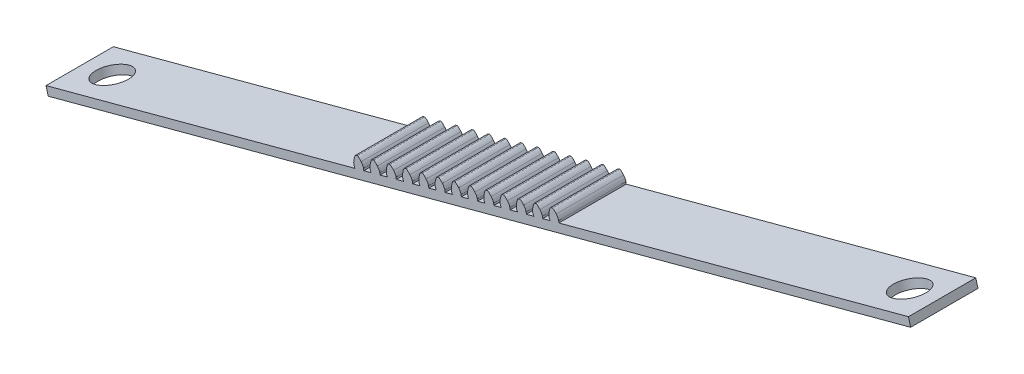
from build123d import *

# Parameters (mm, degrees)
BOSS_EXTRUDE1_DEPTH = 25.4
SKETCH2_W           = 25.4
SKETCH2_H           = 3.175
BOSS_EXTRUDE2_DEPTH = 57.15
SKETCH3_W           = 25.4
SKETCH3_H           = 3.175
BOSS_EXTRUDE3_DEPTH = 53.975
SKETCH4_R           = 6.35
CUT_EXTRUDE3_DEPTH  = 25.4
SKETCH5_R           = 6.35
CUT_EXTRUDE4_DEPTH  = 10


with BuildPart() as part:
    # Sketch1 → Boss-Extrude1 (new body)
    with BuildSketch(Plane.XY):
        with BuildLine():
            Line((44.647261736, 20.714486461), (-16.689028233, 4.279477097))
            Line((-16.689028233, 4.279477097), (-15.867277765, 1.212662598))
            Line((-15.867277765, 1.212662598), (202.166329374, 59.634591554))
            Line((202.166329374, 59.634591554), (201.344578906, 62.701406052))
            Line((201.344578906, 62.701406052), (121.586879759, 41.330394976))
            Line((121.586879759, 41.330394976), (121.513391285, 42.056075093))
            add(Edge.make_bspline(
                [(121.513391285, 42.056075093), (121.260009346, 43.020021571), (120.595314393, 43.773827223)],
                knots=[0, 0, 0, 1, 1, 1], degree=2))
            add(Edge.make_bspline(
                [(120.595314393, 43.773827223), (120.275189395, 44.15849811), (119.801750125, 44.644816566), (119.29209413, 45.027722731), (119.109538558, 44.986289964)],
                knots=[0, 0, 0, 0, 0.77483603, 1, 1, 1, 1], degree=3))
            Line((119.109538558, 44.986289964), (118.568302619, 44.841266231))
            add(Edge.make_bspline(
                [(117.887814373, 43.048354779), (117.972715311, 43.541552038), (118.139566517, 44.19943581), (118.389488473, 44.785870274), (118.568302619, 44.841266231)],
                knots=[0, 0, 0, 0, 0.77483603, 1, 1, 1, 1], degree=3))
            add(Edge.make_bspline(
                [(117.951612527, 41.101699351), (117.689074484, 42.063192458), (117.887814373, 43.048354779)],
                knots=[0, 0, 0, 1, 1, 1], degree=2))
            Line((117.951612527, 41.101699351), (118.2508097, 40.436497698))
            Line((118.2508097, 40.436497698), (115.453250762, 39.68689404))
            Line((115.453250762, 39.686894039), (115.379762288, 40.412574156))
            add(Edge.make_bspline(
                [(115.379762288, 40.412574156), (115.126380349, 41.376520634), (114.461685396, 42.130326286)],
                knots=[0, 0, 0, 1, 1, 1], degree=2))
            add(Edge.make_bspline(
                [(114.461685396, 42.130326286), (114.141560398, 42.514997173), (113.668121128, 43.001315629), (113.158465133, 43.384221795), (112.975909561, 43.342789028)],
                knots=[0, 0, 0, 0, 0.77483603, 1, 1, 1, 1], degree=3))
            Line((112.975909561, 43.342789028), (112.434673622, 43.197765295))
            add(Edge.make_bspline(
                [(111.754185376, 41.404853842), (111.839086314, 41.898051102), (112.00593752, 42.555934874), (112.255859476, 43.142369338), (112.434673622, 43.197765295)],
                knots=[0, 0, 0, 0, 0.77483603, 1, 1, 1, 1], degree=3))
            add(Edge.make_bspline(
                [(111.81798353, 39.458198414), (111.555445487, 40.419691522), (111.754185376, 41.404853842)],
                knots=[0, 0, 0, 1, 1, 1], degree=2))
            Line((111.81798353, 39.458198414), (112.117180703, 38.792996761))
            Line((112.117180703, 38.792996761), (109.319621765, 38.043393103))
            Line((109.319621765, 38.043393103), (109.246133292, 38.76907322))
            add(Edge.make_bspline(
                [(109.246133292, 38.76907322), (108.992751352, 39.733019698), (108.328056399, 40.48682535)],
                knots=[0, 0, 0, 1, 1, 1], degree=2))
            add(Edge.make_bspline(
                [(108.328056399, 40.48682535), (108.007931401, 40.871496237), (107.534492131, 41.357814693), (107.024836136, 41.740720858), (106.842280564, 41.699288091)],
                knots=[0, 0, 0, 0, 0.77483603, 1, 1, 1, 1], degree=3))
            Line((106.842280564, 41.699288091), (106.301044626, 41.554264359))
            add(Edge.make_bspline(
                [(105.620556379, 39.761352906), (105.705457317, 40.254550166), (105.872308523, 40.912433937), (106.122230479, 41.498868401), (106.301044626, 41.554264359)],
                knots=[0, 0, 0, 0, 0.77483603, 1, 1, 1, 1], degree=3))
            add(Edge.make_bspline(
                [(105.684354533, 37.814697478), (105.42181649, 38.776190586), (105.620556379, 39.761352906)],
                knots=[0, 0, 0, 1, 1, 1], degree=2))
            Line((105.684354533, 37.814697478), (105.983551706, 37.149495825))
            Line((105.983551706, 37.149495825), (103.185992768, 36.399892167))
            Line((103.185992768, 36.399892167), (103.112504295, 37.125572283))
            add(Edge.make_bspline(
                [(103.112504295, 37.125572283), (102.859122355, 38.089518762), (102.194427402, 38.843324413)],
                knots=[0, 0, 0, 1, 1, 1], degree=2))
            add(Edge.make_bspline(
                [(102.194427402, 38.843324413), (101.874302404, 39.227995301), (101.400863134, 39.714313756), (100.891207139, 40.097219922), (100.708651567, 40.055787155)],
                knots=[0, 0, 0, 0, 0.77483603, 1, 1, 1, 1], degree=3))
            Line((100.708651567, 40.055787155), (100.167415629, 39.910763422))
            add(Edge.make_bspline(
                [(99.486927382, 38.117851969), (99.57182832, 38.611049229), (99.738679526, 39.268933001), (99.988601482, 39.855367465), (100.167415629, 39.910763422)],
                knots=[0, 0, 0, 0, 0.77483603, 1, 1, 1, 1], degree=3))
            add(Edge.make_bspline(
                [(99.550725536, 36.171196541), (99.288187493, 37.132689649), (99.486927382, 38.117851969)],
                knots=[0, 0, 0, 1, 1, 1], degree=2))
            Line((99.550725536, 36.171196541), (99.849922709, 35.505994888))
            Line((99.849922709, 35.505994888), (97.052363772, 34.75639123))
            Line((97.052363772, 34.75639123), (96.978875298, 35.482071347))
            add(Edge.make_bspline(
                [(96.978875298, 35.482071347), (96.725493358, 36.446017825), (96.060798405, 37.199823477)],
                knots=[0, 0, 0, 1, 1, 1], degree=2))
            add(Edge.make_bspline(
                [(96.060798405, 37.199823477), (95.740673407, 37.584494364), (95.267234137, 38.07081282), (94.757578143, 38.453718985), (94.575022571, 38.412286218)],
                knots=[0, 0, 0, 0, 0.77483603, 1, 1, 1, 1], degree=3))
            Line((94.575022571, 38.412286218), (94.033786632, 38.267262486))
            add(Edge.make_bspline(
                [(93.353298385, 36.474351033), (93.438199323, 36.967548293), (93.605050529, 37.625432065), (93.854972485, 38.211866529), (94.033786632, 38.267262486)],
                knots=[0, 0, 0, 0, 0.77483603, 1, 1, 1, 1], degree=3))
            add(Edge.make_bspline(
                [(93.417096539, 34.527695605), (93.154558496, 35.489188713), (93.353298385, 36.474351033)],
                knots=[0, 0, 0, 1, 1, 1], degree=2))
            Line((93.417096539, 34.527695605), (93.716293712, 33.862493952))
            Line((93.716293712, 33.862493952), (90.918734775, 33.112890294))
            Line((90.918734775, 33.112890294), (90.845246301, 33.838570411))
            add(Edge.make_bspline(
                [(90.845246301, 33.838570411), (90.591864361, 34.802516889), (89.927169408, 35.556322541)],
                knots=[0, 0, 0, 1, 1, 1], degree=2))
            add(Edge.make_bspline(
                [(89.927169408, 35.556322541), (89.60704441, 35.940993428), (89.13360514, 36.427311884), (88.623949146, 36.810218049), (88.441393574, 36.768785282)],
                knots=[0, 0, 0, 0, 0.77483603, 1, 1, 1, 1], degree=3))
            Line((88.441393574, 36.768785282), (87.900157635, 36.623761549))
            add(Edge.make_bspline(
                [(87.219669388, 34.830850097), (87.304570326, 35.324047356), (87.471421532, 35.981931128), (87.721343488, 36.568365592), (87.900157635, 36.623761549)],
                knots=[0, 0, 0, 0, 0.77483603, 1, 1, 1, 1], degree=3))
            add(Edge.make_bspline(
                [(87.283467542, 32.884194669), (87.020929499, 33.845687776), (87.219669388, 34.830850097)],
                knots=[0, 0, 0, 1, 1, 1], degree=2))
            Line((87.283467542, 32.884194669), (87.582664715, 32.218993016))
            Line((87.582664715, 32.218993016), (84.785105778, 31.469389357))
            Line((84.785105778, 31.469389357), (84.711617304, 32.195069474))
            add(Edge.make_bspline(
                [(84.711617304, 32.195069474), (84.458235364, 33.159015952), (83.793540411, 33.912821604)],
                knots=[0, 0, 0, 1, 1, 1], degree=2))
            add(Edge.make_bspline(
                [(83.793540411, 33.912821604), (83.473415413, 34.297492491), (82.999976143, 34.783810947), (82.490320149, 35.166717113), (82.307764577, 35.125284346)],
                knots=[0, 0, 0, 0, 0.77483603, 1, 1, 1, 1], degree=3))
            Line((82.307764577, 35.125284346), (81.766528638, 34.980260613))
            add(Edge.make_bspline(
                [(81.086040391, 33.18734916), (81.170941329, 33.68054642), (81.337792535, 34.338430192), (81.587714491, 34.924864656), (81.766528638, 34.980260613)],
                knots=[0, 0, 0, 0, 0.77483603, 1, 1, 1, 1], degree=3))
            add(Edge.make_bspline(
                [(81.149838545, 31.240693732), (80.887300503, 32.20218684), (81.086040391, 33.18734916)],
                knots=[0, 0, 0, 1, 1, 1], degree=2))
            Line((81.149838545, 31.240693732), (81.449035718, 30.575492079))
            Line((81.449035718, 30.575492079), (78.651476781, 29.825888421))
            Line((78.651476781, 29.825888421), (78.577988307, 30.551568538))
            add(Edge.make_bspline(
                [(78.577988307, 30.551568538), (78.324606367, 31.515515016), (77.659911415, 32.269320668)],
                knots=[0, 0, 0, 1, 1, 1], degree=2))
            add(Edge.make_bspline(
                [(77.659911415, 32.269320668), (77.339786416, 32.653991555), (76.866347147, 33.140310011), (76.356691152, 33.523216176), (76.17413558, 33.481783409)],
                knots=[0, 0, 0, 0, 0.77483603, 1, 1, 1, 1], degree=3))
            Line((76.17413558, 33.481783409), (75.632899641, 33.336759677))
            add(Edge.make_bspline(
                [(74.952411394, 31.543848224), (75.037312332, 32.037045484), (75.204163539, 32.694929255), (75.454085494, 33.281363719), (75.632899641, 33.336759677)],
                knots=[0, 0, 0, 0, 0.77483603, 1, 1, 1, 1], degree=3))
            add(Edge.make_bspline(
                [(75.016209548, 29.597192796), (74.753671506, 30.558685904), (74.952411394, 31.543848224)],
                knots=[0, 0, 0, 1, 1, 1], degree=2))
            Line((75.016209548, 29.597192796), (75.315406721, 28.931991143))
            Line((75.315406721, 28.931991143), (72.517847784, 28.182387485))
            Line((72.517847784, 28.182387485), (72.44435931, 28.908067601))
            add(Edge.make_bspline(
                [(72.44435931, 28.908067601), (72.19097737, 29.87201408), (71.526282418, 30.625819731)],
                knots=[0, 0, 0, 1, 1, 1], degree=2))
            add(Edge.make_bspline(
                [(71.526282418, 30.625819731), (71.206157419, 31.010490619), (70.73271815, 31.496809074), (70.223062155, 31.87971524), (70.040506583, 31.838282473)],
                knots=[0, 0, 0, 0, 0.77483603, 1, 1, 1, 1], degree=3))
            Line((70.040506583, 31.838282473), (69.499270644, 31.69325874))
            add(Edge.make_bspline(
                [(68.818782397, 29.900347287), (68.903683335, 30.393544547), (69.070534542, 31.051428319), (69.320456498, 31.637862783), (69.499270644, 31.69325874)],
                knots=[0, 0, 0, 0, 0.77483603, 1, 1, 1, 1], degree=3))
            add(Edge.make_bspline(
                [(68.882580551, 27.953691859), (68.620042509, 28.915184967), (68.818782397, 29.900347287)],
                knots=[0, 0, 0, 1, 1, 1], degree=2))
            Line((68.882580551, 27.953691859), (69.181777724, 27.288490206))
            Line((69.181777724, 27.288490206), (66.384218787, 26.538886548))
            Line((66.384218787, 26.538886548), (66.310730313, 27.264566665))
            add(Edge.make_bspline(
                [(66.310730313, 27.264566665), (66.057348373, 28.228513143), (65.392653421, 28.982318795)],
                knots=[0, 0, 0, 1, 1, 1], degree=2))
            add(Edge.make_bspline(
                [(65.392653421, 28.982318795), (65.072528422, 29.366989682), (64.599089153, 29.853308138), (64.089433158, 30.236214303), (63.906877586, 30.194781536)],
                knots=[0, 0, 0, 0, 0.77483603, 1, 1, 1, 1], degree=3))
            Line((63.906877586, 30.194781536), (63.365641647, 30.049757804))
            add(Edge.make_bspline(
                [(62.685153401, 28.256846351), (62.770054338, 28.750043611), (62.936905545, 29.407927383), (63.186827501, 29.994361847), (63.365641647, 30.049757804)],
                knots=[0, 0, 0, 0, 0.77483603, 1, 1, 1, 1], degree=3))
            add(Edge.make_bspline(
                [(62.748951554, 26.310190923), (62.486413512, 27.271684031), (62.685153401, 28.256846351)],
                knots=[0, 0, 0, 1, 1, 1], degree=2))
            Line((62.748951554, 26.310190923), (63.048148727, 25.64498927))
            Line((63.048148727, 25.64498927), (60.25058979, 24.895385612))
            Line((60.25058979, 24.895385612), (60.177101316, 25.621065729))
            add(Edge.make_bspline(
                [(60.177101316, 25.621065729), (59.923719376, 26.585012207), (59.259024424, 27.338817859)],
                knots=[0, 0, 0, 1, 1, 1], degree=2))
            add(Edge.make_bspline(
                [(59.259024424, 27.338817859), (58.938899425, 27.723488746), (58.465460156, 28.209807202), (57.955804161, 28.592713367), (57.773248589, 28.5512806)],
                knots=[0, 0, 0, 0, 0.77483603, 1, 1, 1, 1], degree=3))
            Line((57.773248589, 28.5512806), (57.23201265, 28.406256867))
            add(Edge.make_bspline(
                [(56.551524404, 26.613345415), (56.636425341, 27.106542674), (56.803276548, 27.764426446), (57.053198504, 28.35086091), (57.23201265, 28.406256867)],
                knots=[0, 0, 0, 0, 0.77483603, 1, 1, 1, 1], degree=3))
            add(Edge.make_bspline(
                [(56.615322557, 24.666689987), (56.352784515, 25.628183094), (56.551524404, 26.613345415)],
                knots=[0, 0, 0, 1, 1, 1], degree=2))
            Line((56.615322557, 24.666689987), (56.91451973, 24.001488334))
            Line((56.91451973, 24.001488334), (54.116960793, 23.251884675))
            Line((54.116960793, 23.251884675), (54.043472319, 23.977564792))
            add(Edge.make_bspline(
                [(54.043472319, 23.977564792), (53.790090379, 24.94151127), (53.125395427, 25.695316922)],
                knots=[0, 0, 0, 1, 1, 1], degree=2))
            add(Edge.make_bspline(
                [(53.125395427, 25.695316922), (52.805270428, 26.079987809), (52.331831159, 26.566306265), (51.822175164, 26.949212431), (51.639619592, 26.907779664)],
                knots=[0, 0, 0, 0, 0.77483603, 1, 1, 1, 1], degree=3))
            Line((51.639619592, 26.907779664), (51.098383653, 26.762755931))
            add(Edge.make_bspline(
                [(50.417895407, 24.969844478), (50.502796344, 25.463041738), (50.669647551, 26.12092551), (50.919569507, 26.707359974), (51.098383653, 26.762755931)],
                knots=[0, 0, 0, 0, 0.77483603, 1, 1, 1, 1], degree=3))
            add(Edge.make_bspline(
                [(50.48169356, 23.02318905), (50.219155518, 23.984682158), (50.417895407, 24.969844478)],
                knots=[0, 0, 0, 1, 1, 1], degree=2))
            Line((50.48169356, 23.02318905), (50.780890733, 22.357987397))
            Line((50.780890733, 22.357987397), (47.983331796, 21.608383739))
            Line((47.983331796, 21.608383739), (47.909843322, 22.334063856))
            add(Edge.make_bspline(
                [(47.909843322, 22.334063856), (47.656461382, 23.298010334), (46.99176643, 24.051815986)],
                knots=[0, 0, 0, 1, 1, 1], degree=2))
            add(Edge.make_bspline(
                [(46.99176643, 24.051815986), (46.671641431, 24.436486873), (46.198202162, 24.922805329), (45.688546167, 25.305711494), (45.505990595, 25.264278727)],
                knots=[0, 0, 0, 0, 0.77483603, 1, 1, 1, 1], degree=3))
            Line((45.505990595, 25.264278727), (44.964754656, 25.119254995))
            add(Edge.make_bspline(
                [(44.28426641, 23.326343542), (44.369167347, 23.819540802), (44.536018554, 24.477424573), (44.78594051, 25.063859037), (44.964754656, 25.119254995)],
                knots=[0, 0, 0, 0, 0.77483603, 1, 1, 1, 1], degree=3))
            add(Edge.make_bspline(
                [(44.348064563, 21.379688114), (44.085526521, 22.341181222), (44.28426641, 23.326343542)],
                knots=[0, 0, 0, 1, 1, 1], degree=2))
            Line((44.348064563, 21.379688114), (44.647261736, 20.714486461))
        make_face()
    extrude(amount=BOSS_EXTRUDE1_DEPTH)

    # Sketch2 → Boss-Extrude2 (add)
    with BuildSketch(Plane(origin=(-14.501206049, -3.88558645, 0), x_dir=(0, 0, 1), z_dir=(-0.9659258262890567, -0.25881904510256404, 0))):
        with Locations((12.7, 6.865595802)):
            Rectangle(SKETCH2_W, SKETCH2_H)
    extrude(amount=BOSS_EXTRUDE2_DEPTH)

    # Sketch3 → Boss-Extrude3 (add)
    with BuildSketch(Plane(origin=(203.53240109, 54.536342506, 0), x_dir=(0, 0, -1), z_dir=(0.9659258262890565, 0.2588190451025651, 0))):
        with Locations((-12.7, 6.865595802)):
            Rectangle(SKETCH3_W, SKETCH3_H)
    extrude(amount=BOSS_EXTRUDE3_DEPTH)

    # Sketch4 → Cut-Extrude3 (cut)
    with BuildSketch(Plane(origin=(-2.187822184, 8.165063547, 0), x_dir=(0.9659258262890567, 0.25881904510256404, 0), z_dir=(-0.25881904510256404, 0.9659258262890567, 0))):
        with Locations((-59.46275321, -12.7)):
            Circle(SKETCH4_R)
    extrude(amount=-CUT_EXTRUDE3_DEPTH, mode=Mode.SUBTRACT)

    # Sketch5 → Cut-Extrude4 (cut)
    with BuildSketch(Plane(origin=(-2.187822184, 8.165063547, 0), x_dir=(0.9659258262890594, 0.2588190451025539, 0), z_dir=(-0.2588190451025539, 0.9659258262890594, 0))):
        with Locations((251.98724679, -12.7)):
            Circle(SKETCH5_R)
    extrude(amount=-CUT_EXTRUDE4_DEPTH, mode=Mode.SUBTRACT)


solid = part.part
